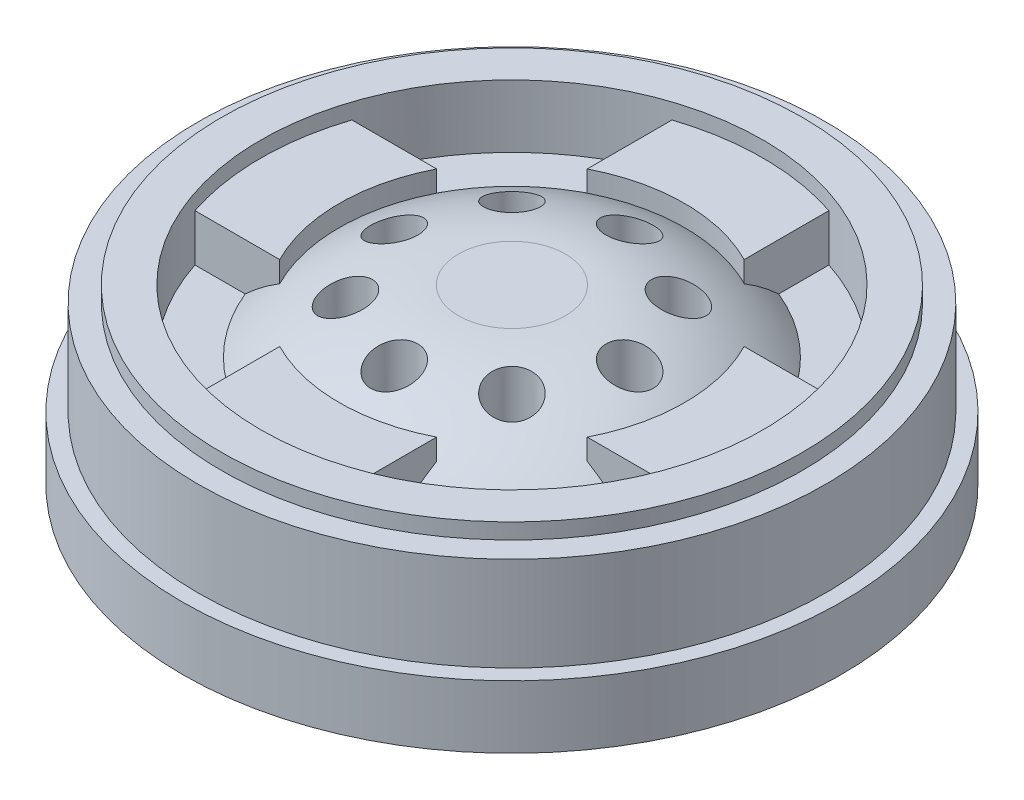
from build123d import *

# Parameters (mm, degrees)
SKETCH1_R           = 21
BOSS_EXTRUDE1_DEPTH = 4
SKETCH2_R           = 20
SKETCH2_R_2         = 18.5
BOSS_EXTRUDE2_DEPTH = 6
SKETCH2_3_R         = 18.5
SKETCH2_3_R_2       = 16
BOSS_EXTRUDE3_DEPTH = 7
SKETCH2_4_R         = 16
SKETCH2_4_R_2       = 13
BOSS_EXTRUDE4_DEPTH = 3
SKETCH2_5_R         = 13
BOSS_EXTRUDE5_DEPTH = 7
SKETCH4_W           = 10
SKETCH4_H           = 1
BOSS_EXTRUDE6_DEPTH = 3
FILLET1_R           = 13.5
BOSS_EXTRUDE7_REACH = 43.848
SKETCH7_W           = 10
SKETCH7_H           = 3
BOSS_EXTRUDE8_REACH = 43.848
SKETCH7_2_W         = 10
SKETCH7_2_H         = 3
CIRPATTERN1_COUNT   = 4
CUT_EXTRUDE1_START  = -2.336817112
CUT_EXTRUDE1_DEPTH  = 1.336817112
SKETCH10_R          = 1.5
CUT_EXTRUDE3_DEPTH  = 4
CIRPATTERN2_COUNT   = 8
SKETCH11_R          = 5
CUT_EXTRUDE4_DEPTH  = 4.2


with BuildPart() as part:
    # Sketch1 → Boss-Extrude1 (new body)
    with BuildSketch(Plane(origin=(0, 0, 0), x_dir=(1, 0, 0), z_dir=(0, 1, 0))):
        with Locations(Location((0, 0, 0), (0, 0, 270))):
            Circle(SKETCH1_R)
    extrude(amount=BOSS_EXTRUDE1_DEPTH)

    # Sketch2 → Boss-Extrude2 (add)
    with BuildSketch(Plane(origin=(0, 4, 0), x_dir=(1, 0, 0), z_dir=(0, 1, 0))):
        with Locations(Location((0, 0, 0), (0, 0, 270))):
            Circle(SKETCH2_R)
        with Locations(Location((0, 0, 0), (0, 0, 270))):
            Circle(SKETCH2_R_2, mode=Mode.SUBTRACT)
    extrude(amount=BOSS_EXTRUDE2_DEPTH)

    # Sketch2<3> → Boss-Extrude3 (add)
    with BuildSketch(Plane(origin=(0, 4, 0), x_dir=(1, 0, 0), z_dir=(0, 1, 0))):
        with Locations(Location((0, 0, 0), (0, 0, 90))):
            Circle(SKETCH2_3_R)
        with Locations(Location((0, 0, 0), (0, 0, 90))):
            Circle(SKETCH2_3_R_2, mode=Mode.SUBTRACT)
    extrude(amount=BOSS_EXTRUDE3_DEPTH)

    # Sketch2<4> → Boss-Extrude4 (add)
    with BuildSketch(Plane(origin=(0, 4, 0), x_dir=(1, 0, 0), z_dir=(0, 1, 0))):
        with Locations(Location((0, 0, 0), (0, 0, 90))):
            Circle(SKETCH2_4_R)
        with Locations(Location((0, 0, 0), (0, 0, 270))):
            Circle(SKETCH2_4_R_2, mode=Mode.SUBTRACT)
    extrude(amount=BOSS_EXTRUDE4_DEPTH)

    # Sketch2<5> → Boss-Extrude5 (add)
    with BuildSketch(Plane(origin=(0, 4, 0), x_dir=(1, 0, 0), z_dir=(0, 1, 0))):
        with Locations(Location((0, 0, 0), (0, 0, 270))):
            Circle(SKETCH2_5_R)
    extrude(amount=BOSS_EXTRUDE5_DEPTH)

    # Sketch4 → Boss-Extrude6 (add)
    with BuildSketch(Plane(origin=(0, 7, 0), x_dir=(1, 0, 0), z_dir=(0, 1, 0))):
        with Locations((0, 13.985764963)):
            Rectangle(SKETCH4_W, SKETCH4_H)
    extrude(amount=BOSS_EXTRUDE6_DEPTH)

    # Fillet1
    # the kernel refuses this fillet: 13.5 mm, written as the material it takes off along each edge
    with BuildSketch(Plane(origin=(0, 11, 0), x_dir=(0, 0, 1), z_dir=(-1, 0, 0))) as fillet1_piece_1:
        with BuildLine():
            CenterArc((3.408336953, -13.5), FILLET1_R, 44.724913155, 45.275086845)
            Line((3.408336953, 0), (3.408336953, 0.27))
            Line((3.408336953, 0.27), (13, 0.27))
            Line((13, 0.27), (13.27, 0))
            ThreePointArc((13.27, 0), (13.27, -2), (13.191833261, -3.81))
            Line((13.191833261, -3.81), (13, -4))
        make_face()
    revolve(axis=Axis((0, 11, 0), (0, 1, 0)), mode=Mode.SUBTRACT)

    # Sketch7 → Boss-Extrude7 (add, up to next)
    with BuildSketch(Plane.XY.offset(-13.485764963), mode=Mode.PRIVATE) as boss_extrude7_sk1:
        with Locations((0, 8.5)):
            Rectangle(SKETCH7_W, SKETCH7_H)
    boss_extrude7_tool1 = extrude(boss_extrude7_sk1.sketch, amount=BOSS_EXTRUDE7_REACH, mode=Mode.PRIVATE) - part.part
    boss_extrude7 = boss_extrude7_tool1.solids().sort_by_distance((0, 8.5, -13.485765))[0]
    add(boss_extrude7)

    # Sketch7<2> → Boss-Extrude8 (add, up to next)
    with BuildSketch(Plane.XY.offset(-13.485764963), mode=Mode.PRIVATE) as boss_extrude8_sk1:
        with Locations((0, 8.5)):
            Rectangle(SKETCH7_2_W, SKETCH7_2_H)
    boss_extrude8_tool1 = extrude(boss_extrude8_sk1.sketch, amount=-BOSS_EXTRUDE8_REACH, mode=Mode.PRIVATE) - part.part
    boss_extrude8 = boss_extrude8_tool1.solids().sort_by_distance((0, 8.5, -13.485765))[0]
    add(boss_extrude8)

    # CirPattern1: Boss-Extrude7, Boss-Extrude8; each copy of Boss-Extrude7, Boss-Extrude8 runs up to whatever stops it at its own place
    cirpattern1_before = part.part  # the part as the pattern finds it: every copy runs up to it
    cirpattern1_boss_extrude7_long = extrude(boss_extrude7_sk1.sketch, amount=BOSS_EXTRUDE7_REACH, mode=Mode.PRIVATE)
    cirpattern1_boss_extrude7_tool1 = cirpattern1_boss_extrude7_long.rotate(Axis((0, 0, 0), (0, 1, 0)), 1 * 360 / CIRPATTERN1_COUNT) - cirpattern1_before
    add(cirpattern1_boss_extrude7_tool1.solids().sort_by_distance((-13.485765, 8.5, 0))[0])
    cirpattern1_boss_extrude7_tool2 = cirpattern1_boss_extrude7_long.rotate(Axis((0, 0, 0), (0, 1, 0)), 2 * 360 / CIRPATTERN1_COUNT) - cirpattern1_before
    add(cirpattern1_boss_extrude7_tool2.solids().sort_by_distance((0, 8.5, 13.485765))[0])
    cirpattern1_boss_extrude7_tool3 = cirpattern1_boss_extrude7_long.rotate(Axis((0, 0, 0), (0, 1, 0)), 3 * 360 / CIRPATTERN1_COUNT) - cirpattern1_before
    add(cirpattern1_boss_extrude7_tool3.solids().sort_by_distance((13.485765, 8.5, 0))[0])
    cirpattern1_boss_extrude8_long = extrude(boss_extrude8_sk1.sketch, amount=-BOSS_EXTRUDE8_REACH, mode=Mode.PRIVATE)
    cirpattern1_boss_extrude8_tool1 = cirpattern1_boss_extrude8_long.rotate(Axis((0, 0, 0), (0, 1, 0)), 1 * 360 / CIRPATTERN1_COUNT) - cirpattern1_before
    add(cirpattern1_boss_extrude8_tool1.solids().sort_by_distance((-13.485765, 8.5, 0))[0])
    cirpattern1_boss_extrude8_tool2 = cirpattern1_boss_extrude8_long.rotate(Axis((0, 0, 0), (0, 1, 0)), 2 * 360 / CIRPATTERN1_COUNT) - cirpattern1_before
    add(cirpattern1_boss_extrude8_tool2.solids().sort_by_distance((0, 8.5, 13.485765))[0])
    cirpattern1_boss_extrude8_tool3 = cirpattern1_boss_extrude8_long.rotate(Axis((0, 0, 0), (0, 1, 0)), 3 * 360 / CIRPATTERN1_COUNT) - cirpattern1_before
    add(cirpattern1_boss_extrude8_tool3.solids().sort_by_distance((13.485765, 8.5, 0))[0])

    # Cut-Extrude1: read off the stored shape, not the designer's step
    # Cut-Extrude1 outline → Cut-Extrude1 (cut)
    with BuildSketch(Plane(origin=(0, 11, 0), x_dir=(1, 0, 0), z_dir=(0, 1, 0)).offset(CUT_EXTRUDE1_START)):
        with BuildLine():
            Line((-15.198684154, 5), (-9.797958971, 5))
            ThreePointArc((-9.797958971, 5), (-11, 0), (-9.797958971, -5))
            Line((-9.797958971, -5), (-15.198684154, -5))
            ThreePointArc((-15.198684154, -5), (-11.313708499, -11.313708499), (-5, -15.198684154))
            Line((-5, -15.198684154), (-5, -9.797958971))
            ThreePointArc((-5, -9.797958971), (0, -11), (5, -9.797958971))
            Line((5, -9.797958971), (5, -15.198684154))
            ThreePointArc((5, -15.198684154), (11.313708499, -11.313708499), (15.198684154, -5))
            Line((15.198684154, -5), (9.797958971, -5))
            ThreePointArc((9.797958971, -5), (11, 0), (9.797958971, 5))
            Line((9.797958971, 5), (15.198684154, 5))
            ThreePointArc((15.198684154, 5), (11.313708499, 11.313708499), (5, 15.198684154))
            Line((5, 15.198684154), (5, 9.797958971))
            ThreePointArc((5, 9.797958971), (0, 11), (-5, 9.797958971))
            Line((-5, 9.797958971), (-5, 15.198684154))
            ThreePointArc((-5, 15.198684154), (-11.313708499, 11.313708499), (-15.198684154, 5))
        make_face()
    extrude(amount=CUT_EXTRUDE1_DEPTH, mode=Mode.SUBTRACT)

    # Cut-Extrude1 2 outline → Cut-Extrude1 2 (revolve)
    with BuildSketch(Plane.XY):
        with BuildLine():
            ThreePointArc((11.000000083, 8.663182832), (9.788785725, 9.397053142), (8.507356468, 10))
            Line((8.507356468, 10), (0, 10))
            Line((0, 10), (0, 8.663182888))
            Line((0, 8.663182888), (11.000000083, 8.663182832))
        make_face()
    revolve(axis=Axis((0, 0, 0), (0, 1, 0)))

    # Sketch10 → Cut-Extrude3 (cut)
    with BuildSketch(Plane(origin=(0, 11, 0), x_dir=(1, 0, 0), z_dir=(0, 1, 0))):
        with Locations(Location((0, 7.5, 0), (0, 0, 270))):
            Circle(SKETCH10_R)
    cut_extrude3 = extrude(amount=-CUT_EXTRUDE3_DEPTH, mode=Mode.SUBTRACT)

    # CirPattern2: Cut-Extrude3 ×8 about axis
    cirpattern2_axis = Axis((0, 0, 0), (0, 1, 0))
    for i in range(1, CIRPATTERN2_COUNT):
        add(cut_extrude3.rotate(cirpattern2_axis, i * 360 / CIRPATTERN2_COUNT), mode=Mode.SUBTRACT)

    # Sketch11 → Cut-Extrude4 (cut)
    with BuildSketch(Plane.XZ):
        with Locations(Location((0, 0, 0), (0, 0, 270))):
            Circle(SKETCH11_R)
    extrude(amount=-CUT_EXTRUDE4_DEPTH, mode=Mode.SUBTRACT)


solid = part.part
